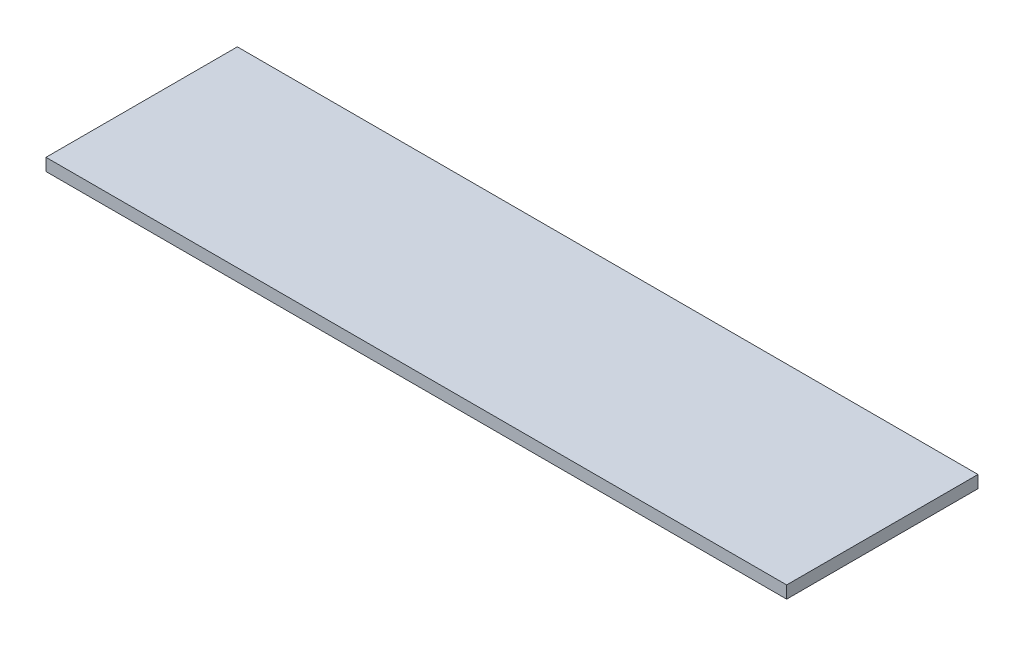
from build123d import *

# Parameters (mm, degrees)
ESQUISSE1_W        = 600
ESQUISSE1_H        = 155
BOSS_EXTRU_1_DEPTH = 10


with BuildPart() as part:
    # Esquisse1 → Boss.-Extru.1 (new body)
    with BuildSketch(Plane(origin=(0, 0, 0), x_dir=(1, 0, 0), z_dir=(0, 1, 0))):
        with Locations((300, 77.5)):
            Rectangle(ESQUISSE1_W, ESQUISSE1_H)
    extrude(amount=BOSS_EXTRU_1_DEPTH)


solid = part.part
